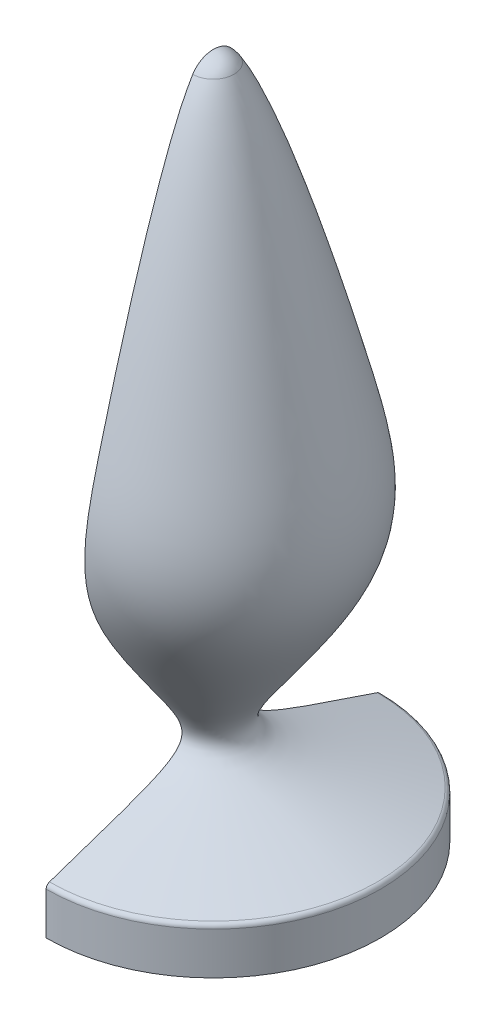
from build123d import *

# Parameters (mm, degrees)
FILLET5_R               = 0.508
CUT_EXTRUDE4_DEPTH      = 25.4
CUT_EXTRUDE4_DEPTH_BACK = 25.4
SKETCH8_W               = 27.315642458
SKETCH8_H               = 195.703997282


with BuildPart() as part:
    # Sketch1 → Revolve1 (revolve)
    with BuildSketch(Plane.XY):
        with BuildLine():
            Line((0, -71.377172013), (0, 0))
            ThreePointArc((0, 0), (1.223734169, -0.314224925), (2.144690561, -1.179153793))
            add(Edge.make_bspline(
                [(2.144690561, -1.179153793), (4.702836967, -5.210786776), (8.980036974, -18.882117933), (14.526259951, -40.98152643), (12.27166851, -46.216037015), (1.146217403, -61.924501885), (0.738552126, -60.947926468), (17.399, -66.614672013)],
                knots=[0.105965392, 0.105965392, 0.105965392, 0.105965392, 0.448012953, 0.508175246, 0.685431315, 0.718366342, 1, 1, 1, 1], degree=3))
            Line((17.399, -66.614672013), (17.399, -71.377172013))
            Line((17.399, -71.377172013), (0, -71.377172013))
        make_face()
    revolve(axis=Axis((0, -71.377172013, 0), (0, 1, 0)))

    # Fillet5
    fillet5_edges = [part.edges().sort_by_distance(p)[0] for p in [
        (-17.399, -66.614672013, 0),
    ]]
    fillet(fillet5_edges, radius=FILLET5_R)

    # Sketch8 → Cut-Extrude4 (cut, two sides: drawn at the far end of the back side and taken through both)
    with BuildSketch(Plane.XY.offset(-CUT_EXTRUDE4_DEPTH_BACK)):
        with Locations((-13.657821229, 0)):
            Rectangle(SKETCH8_W, SKETCH8_H)
    extrude(amount=CUT_EXTRUDE4_DEPTH + CUT_EXTRUDE4_DEPTH_BACK, mode=Mode.SUBTRACT)


solid = part.part
